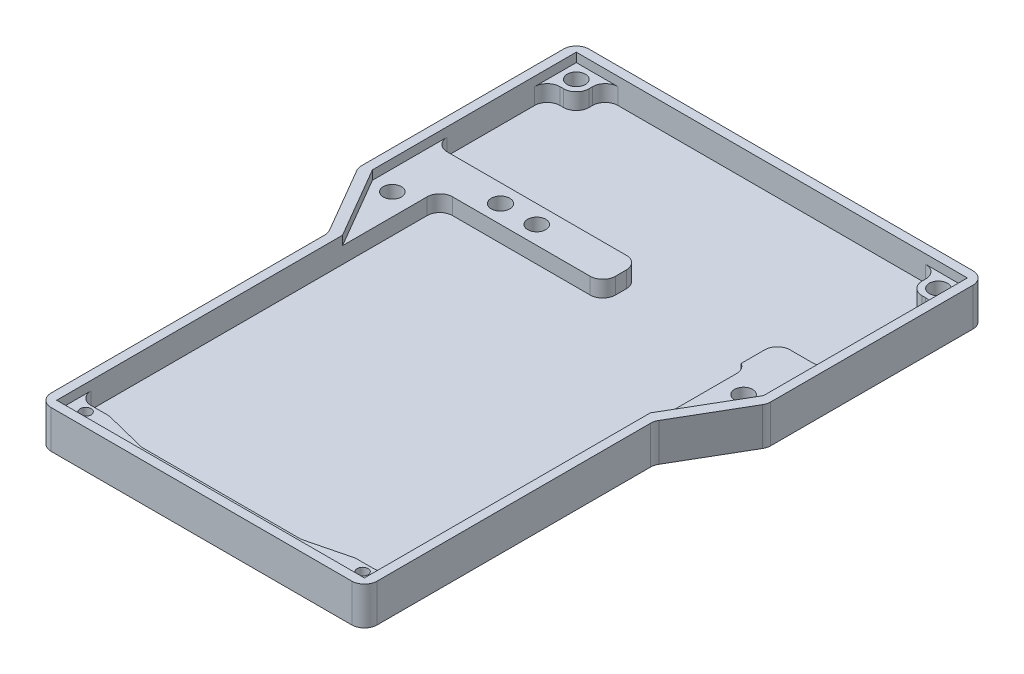
from build123d import *

# Parameters (mm, degrees)
BOSS_EXTRUDE1_DEPTH     = 3.5
BOSS_EXTRUDE2_DEPTH     = 7
SKETCH3_R               = 1.5
SKETCH3_W               = 8
SKETCH3_H               = 8
SKETCH3_R_2             = 2.5
BOSS_EXTRUDE3_DEPTH     = 4.5
SKETCH4_R               = 2.5
BOSS_EXTRUDE4_DEPTH     = 4.5
CUT_EXTRUDE1_DEPTH      = 123.693401635
CUT_EXTRUDE1_DEPTH_BACK = 123.693401635
SKETCH5_R               = 2.5
SKETCH5_R_2             = 2.55926668
SKETCH5_R_3             = 1.5
FILLET1_R               = 3.5


with BuildPart() as part:
    # Sketch1 → Boss-Extrude1 (new body)
    with BuildSketch(Plane(origin=(0, 0, 0), x_dir=(1, 0, 0), z_dir=(0, 1, 0))):
        Polygon((-57.597316241, 51.805869074), (-57.597316241, -8.444130926), (-46.097316241, -28.194130926), (-46.097316241, -108.194130926), (43.902683759, -108.194130926), (43.902683759, -28.194130926), (55.402683759, -8.444130926), (55.402683759, 51.805869074), align=None)
    extrude(amount=BOSS_EXTRUDE1_DEPTH)

    # Sketch2 → Boss-Extrude2 (add)
    with BuildSketch(Plane(origin=(0, 3.5, 0), x_dir=(1, 0, 0), z_dir=(0, 1, 0))):
        Polygon((-46.097316241, -28.194130926), (-46.097316241, -108.194130926), (43.902683759, -108.194130926), (43.902683759, -28.194130926), (41.402683759, -28.194130926), (41.402683759, -105.694130926), (-43.597316241, -105.694130926), (-43.597316241, -28.194130926), align=None)
        Polygon((52.902683759, -6.988434723), (55.402683759, -8.444130926), (43.902683759, -28.194130926), (41.402683759, -26.738434723), align=None)
        Polygon((41.402683759, -28.194130926), (43.902683759, -28.194130926), (41.402683759, -26.738434723), align=None)
        Polygon((52.902683759, -6.988434723), (55.402683759, -8.444130926), (55.402683759, -6.988434723), align=None)
        Polygon((-57.597316241, 51.805869074), (-57.597316241, -6.988434723), (-55.097316241, -6.988434723), (-55.097316241, 49.305869074), (52.902683759, 49.305869074), (52.902683759, -6.988434723), (55.402683759, -6.988434723), (55.402683759, 51.805869074), align=None)
        Polygon((-43.597316241, -26.738434723), (-46.097316241, -28.194130926), (-43.597316241, -28.194130926), align=None)
        Polygon((-43.597316241, -26.738434723), (-46.097316241, -28.194130926), (-57.597316241, -8.444130926), (-55.097316241, -6.988434723), align=None)
        Polygon((-57.597316241, -6.988434723), (-57.597316241, -8.444130926), (-55.097316241, -6.988434723), align=None)
    extrude(amount=BOSS_EXTRUDE2_DEPTH)

    # Sketch3 → Boss-Extrude3 (add)
    # profile 1 of 3: a face of its own
    with BuildSketch(Plane(origin=(0, 3.5, 0), x_dir=(1, 0, 0), z_dir=(0, 1, 0))):
        Polygon((-43.597316241, -99.694130926), (-43.597316241, -105.694130926), (41.402683759, -105.694130926), (41.402683759, -99.694130926), (32.902683759, -99.694130926), (20.902683759, -102.694130926), (-23.097316241, -102.694130926), (-35.097316241, -99.694130926), align=None)
        with Locations(Location((-39.347316241, -101.944130926, 0), (0, 0, 270))):
            Circle(SKETCH3_R, mode=Mode.SUBTRACT)
        with Locations(Location((37.152683759, -101.944130926, 0), (0, 0, 270))):
            Circle(SKETCH3_R, mode=Mode.SUBTRACT)
    # profile 2 of 3: a face of its own
    with BuildSketch(Plane(origin=(0, 3.5, 0), x_dir=(1, 0, 0), z_dir=(0, 1, 0))):
        with Locations((-51.097316241, 45.305869074)):
            Rectangle(SKETCH3_W, SKETCH3_H)
        with Locations(Location((-51.097316241, 45.305869074, 0), (0, 0, 270))):
            Circle(SKETCH3_R_2, mode=Mode.SUBTRACT)
    # profile 3 of 3: a face of its own
    with BuildSketch(Plane(origin=(0, 3.5, 0), x_dir=(1, 0, 0), z_dir=(0, 1, 0))):
        with Locations((48.902683759, 45.305869074)):
            Rectangle(SKETCH3_W, SKETCH3_H)
        with Locations(Location((48.902683759, 45.305869074, 0), (0, 0, 270))):
            Circle(SKETCH3_R_2, mode=Mode.SUBTRACT)
    extrude(amount=BOSS_EXTRUDE3_DEPTH)

    # Sketch4 → Boss-Extrude4 (add)
    # profile 1 of 2: a face of its own
    with BuildSketch(Plane(origin=(0, 3.5, 0), x_dir=(1, 0, 0), z_dir=(0, 1, 0))):
        Polygon((1.402683759, 10.130869074), (-55.097316241, 10.130869074), (-55.097316241, -6.988434723), (-43.597316241, -26.738434723), (-43.597316241, 0.130869074), (1.402683759, 0.130869074), align=None)
        with Locations(Location((-31.847316241, 5.130869074, 0), (0, 0, 90))):
            Circle(SKETCH4_R, mode=Mode.SUBTRACT)
        with Locations(Location((-21.847316241, 5.130869074, 0), (0, 0, 90))):
            Circle(SKETCH4_R, mode=Mode.SUBTRACT)
    # profile 2 of 2: a face of its own
    with BuildSketch(Plane(origin=(0, 3.5, 0), x_dir=(1, 0, 0), z_dir=(0, 1, 0))):
        Polygon((39.6145491, 10.130869074), (39.6145491, 0.130869074), (41.402683759, 0.130869074), (41.402683759, -26.738434723), (52.902683759, -6.988434723), (52.902683759, 10.130869074), align=None)
    extrude(amount=BOSS_EXTRUDE4_DEPTH)

    # Sketch5 → Cut-Extrude1 (cut, two sides: drawn at the far end of the back side and taken through both)
    with BuildSketch(Plane(origin=(0, 5, 0), x_dir=(1, 0, 0), z_dir=(0, 1, 0)).offset(-CUT_EXTRUDE1_DEPTH_BACK)):
        with Locations(Location((-21.847316241, 5.130869074, 0), (0, 0, 90))):
            Circle(SKETCH5_R)
        with Locations(Location((-31.847316241, 5.130869074, 0), (0, 0, 270))):
            Circle(SKETCH5_R_2)
        with Locations(Location((-39.347316241, -101.944130926, 0), (0, 0, 270))):
            Circle(SKETCH5_R_3)
        with Locations(Location((37.152683759, -101.944130926, 0), (0, 0, 270))):
            Circle(SKETCH5_R_3)
        with Locations(Location((-51.097316241, 45.305869074, 0), (0, 0, 270))):
            Circle(SKETCH5_R)
        with Locations(Location((48.902683759, 45.305869074, 0), (0, 0, 270))):
            Circle(SKETCH5_R)
        with Locations(Location((-49.597316241, -6.988434723, 0), (0, 0, 270))):
            Circle(SKETCH5_R)
        with Locations(Location((47.402683759, -6.988434723, 0), (0, 0, 270))):
            Circle(SKETCH5_R)
    extrude(amount=CUT_EXTRUDE1_DEPTH + CUT_EXTRUDE1_DEPTH_BACK, mode=Mode.SUBTRACT)

    # Fillet1
    # the kernel refuses this fillet: 3.5 mm, written as the material it adds along each edge
    with BuildSketch(Plane(origin=(41.402683759, 3.5, 99.694130926), x_dir=(0, 0, -1), z_dir=(0, 1, 0)), Plane(origin=(-43.597316241, 3.5, 99.694130926), x_dir=(1, 0, 0), z_dir=(0, 1, 0)), Plane(origin=(-55.097316241, 3.5, -41.305869074), x_dir=(0, 0, 1), z_dir=(0, 1, 0)), Plane(origin=(-47.097316241, 3.5, -49.305869074), x_dir=(0, 0, 1), z_dir=(0, 1, 0)), Plane(origin=(52.902683759, 3.5, -41.305869074), x_dir=(-1, 0, 0), z_dir=(0, 1, 0)), Plane(origin=(-55.097316241, 3.5, -10.130869074), x_dir=(1, 0, 0), z_dir=(0, 1, 0))) as fillet1_piece_1:
        with BuildLine():
            CenterArc((FILLET1_R, FILLET1_R), FILLET1_R, 180, 90)
            Line((0, FILLET1_R), (0, 0))
            Line((0, 0), (FILLET1_R, 0))
        make_face()
    extrude(amount=4.5)
    with BuildSketch(Plane(origin=(20.902683759, 2.422825776, 102.694130926), x_dir=(0.9701425001453338, 0, -0.2425356250363252), z_dir=(0, 1, 0)), Plane(origin=(-23.097316241, 2.422825776, 102.694130926), x_dir=(1, 0, 0), z_dir=(0, 1, 0))) as fillet1_piece_2:
        with BuildLine():
            CenterArc((FILLET1_R * 0.123105625618, FILLET1_R), FILLET1_R, 255.963756532, 14.036243468)
            Line((-FILLET1_R * 0.119429999419, FILLET1_R * 0.0298574998547), (0, 0))
            Line((0, 0), (FILLET1_R * 0.123105625618, 0))
        make_face()
    extrude(amount=5.577174224)
    with BuildSketch(Plane(origin=(44.902683759, 3.5, -49.305869074), x_dir=(0, 0, 1), z_dir=(0, 1, 0)), Plane(origin=(52.902683759, 3.5, -10.130869074), x_dir=(-1, 0, 0), z_dir=(0, 1, 0)), Plane(origin=(-43.597316241, 3.5, -0.130869074), x_dir=(1, 0, 0), z_dir=(0, 1, 0))) as fillet1_piece_3:
        with BuildLine():
            CenterArc((FILLET1_R, -FILLET1_R), FILLET1_R, 90, 90)
            Line((0, -FILLET1_R), (0, 0))
            Line((0, 0), (FILLET1_R, 0))
        make_face()
    extrude(amount=4.5)
    with BuildSketch(Plane(origin=(43.902683759, 10.5, 28.194130926), x_dir=(0, 0, 1), z_dir=(0, -1, 0)), Plane(origin=(-46.097316241, 0, 28.194130926), x_dir=(0, 0, 1), z_dir=(0, 1, 0))) as fillet1_piece_4:
        with BuildLine():
            CenterArc((FILLET1_R * 0.269926710528, -FILLET1_R), FILLET1_R, 90, 30.211322386)
            Line((-FILLET1_R * 0.23326401814, -FILLET1_R * 0.135824618157), (0, 0))
            Line((0, 0), (FILLET1_R * 0.269926710528, 0))
        make_face()
    extrude(amount=10.5)
    with BuildSketch(Plane(origin=(41.402683759, 3.5, -0.130869074), x_dir=(-1, 0, 0), z_dir=(0, 1, 0))) as fillet1_piece_5:
        with BuildLine():
            CenterArc((3.5, 3.052788407), FILLET1_R, 180, 60.718267745)
            Line((0, 3.052788407), (0, 0))
            Line((0, 0), (1.788134659, 0))
        make_face()
    extrude(amount=4.5)
    # the kernel refuses this fillet: 3.5 mm, written as the material it takes off along each edge
    with BuildSketch(Plane(origin=(32.902683759, 3.5, 99.694130926), x_dir=(-0.9701425001453338, 0, 0.2425356250363252), z_dir=(0, 1, 0)), Plane(origin=(-35.097316241, 3.5, 99.694130926), x_dir=(-1, 0, 0), z_dir=(0, 1, 0))) as fillet1_2_piece_1:
        with BuildLine():
            CenterArc((FILLET1_R * 0.123105625618, FILLET1_R), FILLET1_R, 255.963756532, 14.036243468)
            Line((-FILLET1_R * 0.119429999419, FILLET1_R * 0.0298574998547), (0, 0))
            Line((0, 0), (FILLET1_R * 0.123105625618, 0))
        make_face()
    extrude(amount=5.577174224, mode=Mode.SUBTRACT)
    with BuildSketch(Plane(origin=(-47.097316241, 3.5, -41.305869074), x_dir=(0, 0, -1), z_dir=(0, 1, 0)), Plane(origin=(44.902683759, 3.5, -41.305869074), x_dir=(1, 0, 0), z_dir=(0, 1, 0)), Plane(origin=(39.6145491, 3.5, -10.130869074), x_dir=(0, 0, 1), z_dir=(0, 1, 0)), Plane(origin=(1.402683759, 3.5, -10.130869074), x_dir=(-1, 0, 0), z_dir=(0, 1, 0)), Plane(origin=(1.402683759, 3.5, -0.130869074), x_dir=(0, 0, -1), z_dir=(0, 1, 0))) as fillet1_2_piece_2:
        with BuildLine():
            CenterArc((FILLET1_R, FILLET1_R), FILLET1_R, 180, 90)
            Line((0, FILLET1_R), (0, 0))
            Line((0, 0), (FILLET1_R, 0))
        make_face()
    extrude(amount=13.25, mode=Mode.SUBTRACT)
    with BuildSketch(Plane(origin=(55.402683759, 12.861858717, 8.444130926), x_dir=(0, 0, -1), z_dir=(0, -1, 0))) as fillet1_2_piece_3:
        with BuildLine():
            CenterArc((FILLET1_R * 0.269926710528, -FILLET1_R), FILLET1_R, 90, 30.211322386)
            Line((-FILLET1_R * 0.23326401814, -FILLET1_R * 0.135824618157), (0, 0))
            Line((0, 0), (FILLET1_R * 0.269926710528, 0))
        make_face()
    extrude(amount=15.223717434, mode=Mode.SUBTRACT)
    with BuildSketch(Plane(origin=(43.902683759, 19.25, 108.194130926), x_dir=(0, 0, -1), z_dir=(0, -1, 0)), Plane(origin=(55.402683759, -8.75, -51.805869074), x_dir=(0, 0, 1), z_dir=(0, 1, 0))) as fillet1_2_piece_4:
        with BuildLine():
            CenterArc((FILLET1_R, -FILLET1_R), FILLET1_R, 90, 90)
            Line((0, -FILLET1_R), (0, 0))
            Line((0, 0), (FILLET1_R, 0))
        make_face()
    extrude(amount=28, mode=Mode.SUBTRACT)
    with BuildSketch(Plane(origin=(-46.097316241, -8.75, 108.194130926), x_dir=(1, 0, 0), z_dir=(0, 1, 0)), Plane(origin=(-57.597316241, -8.75, -51.805869074), x_dir=(0, 0, 1), z_dir=(0, 1, 0))) as fillet1_2_piece_5:
        with BuildLine():
            CenterArc((FILLET1_R, FILLET1_R), FILLET1_R, 180, 90)
            Line((0, FILLET1_R), (0, 0))
            Line((0, 0), (FILLET1_R, 0))
        make_face()
    extrude(amount=28, mode=Mode.SUBTRACT)
    with BuildSketch(Plane(origin=(-57.597316241, -2.361858717, 8.444130926), x_dir=(0.5031907286678244, 0, 0.8641753818425655), z_dir=(0, 1, 0))) as fillet1_2_piece_6:
        with BuildLine():
            CenterArc((FILLET1_R * 0.269926710528, FILLET1_R), FILLET1_R, 239.788677614, 30.211322386)
            Line((-FILLET1_R * 0.23326401814, FILLET1_R * 0.135824618157), (0, 0))
            Line((0, 0), (FILLET1_R * 0.269926710528, 0))
        make_face()
    extrude(amount=15.223717434, mode=Mode.SUBTRACT)


solid = part.part
